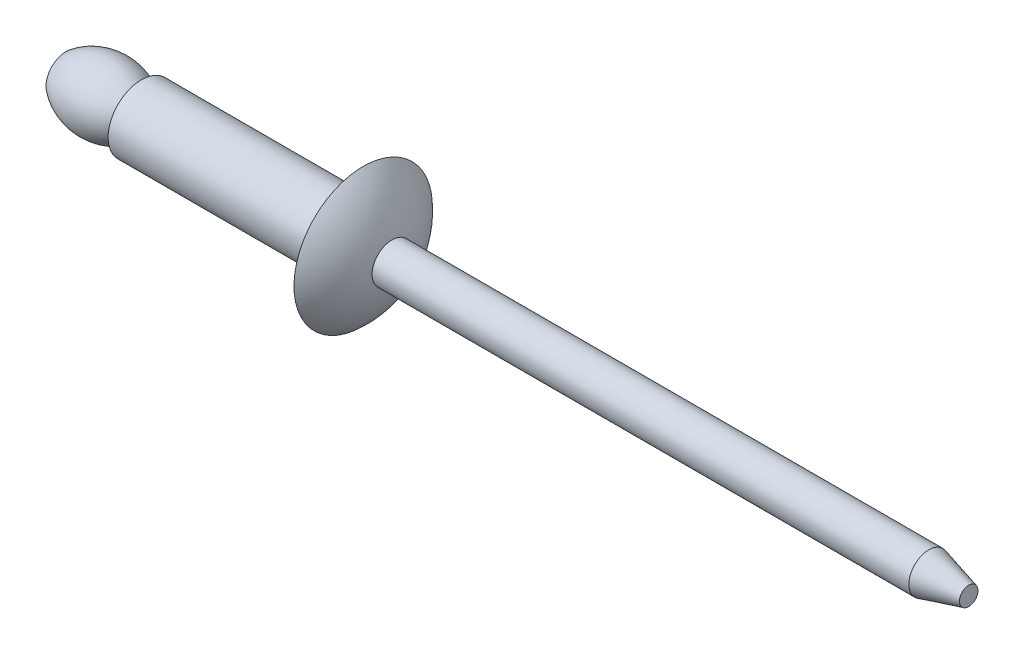
from build123d import *

# Parameters (mm, degrees)
FILLET1_R      = 0.5
CHAMFER1_SIZE  = 1.8
CHAMFER1_SIZE2 = 0.482308546


with BuildPart() as part:
    # Sketch1 → Base-Revolve (revolve)
    with BuildSketch(Plane(origin=(-11.603452862, 14.723452862, 0), x_dir=(0, -1, 0), z_dir=(0, 0, 1))):
        with BuildLine():
            Line((15.623452862, 15.003452862), (16.223452862, 15.003452862))
            Line((16.223452862, 15.003452862), (16.223452862, 25.003452862))
            Line((16.223452862, 25.003452862), (17.843452862, 25.003452862))
            ThreePointArc((17.843452862, 25.003452862), (16.836228646, 25.829648063), (15.623452862, 26.305330759))
            Line((15.623452862, 26.305330759), (15.623452862, 52.305330759))
            Line((15.623452862, 52.305330759), (14.723452862, 52.305330759))
            Line((14.723452862, 52.305330759), (14.723452862, 11.603452862))
            Line((14.723452862, 11.603452862), (15.623452862, 11.603452862))
            ThreePointArc((15.623452862, 11.603452862), (16.223452862, 13.303452862), (15.623452862, 15.003452862))
        make_face()
    revolve(axis=Axis((22.734231882, 0, 0), (-1, 0, 0)))

    # Fillet1
    fillet1_edges = [part.edges().sort_by_distance(p)[0] for p in [
        (13.4, 1.5, 0),
    ]]
    fillet(fillet1_edges, radius=FILLET1_R)

    # Chamfer1
    chamfer1_edges = [part.edges().sort_by_distance(p)[0] for p in [
        (40.701877897, 0.9, 0),
    ]]
    chamfer1_side = [part.faces().sort_by_distance(p)[0] for p in [
        (27.701877897, 0.9, 0),
    ]]
    chamfer(chamfer1_edges, length=CHAMFER1_SIZE, length2=CHAMFER1_SIZE2, reference=chamfer1_side[0])


solid = part.part
